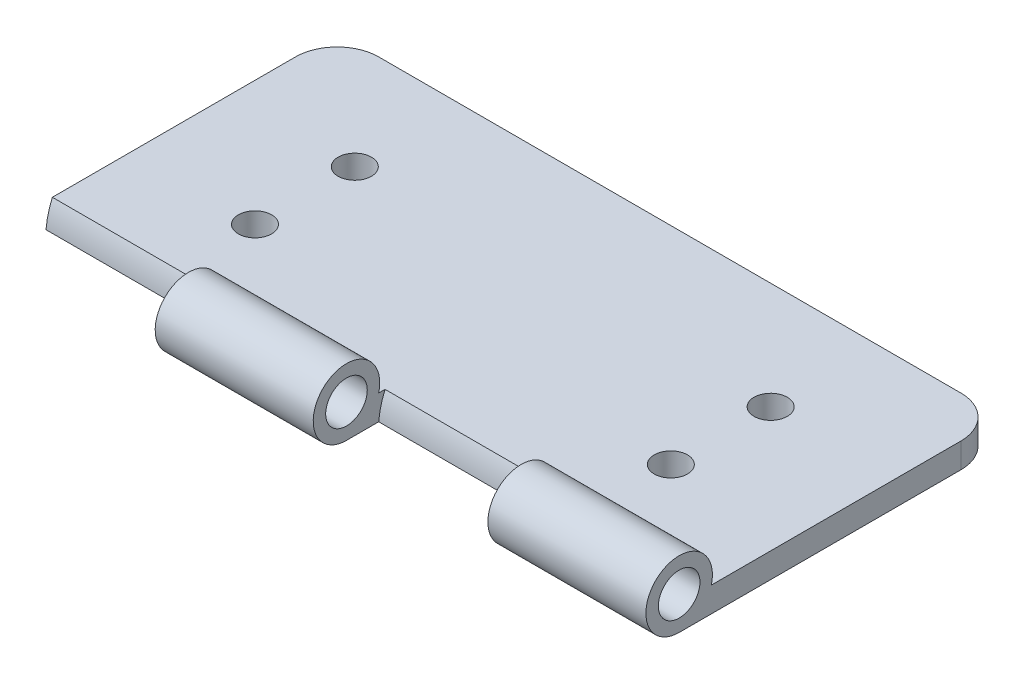
from build123d import *
from OCP.BRepFilletAPI import BRepFilletAPI_MakeChamfer

# Parameters (mm, degrees)
BOSS_EXTRUDE1_DEPTH = 3
SKETCH2_R           = 2.5
BOSS_EXTRUDE2_DEPTH = 19
LPATTERN1_COUNT     = 2
LPATTERN1_PITCH     = 40
CHAMFER3_SIZE       = 1
CHAMFER3_SIZE2      = 0.624869352
FILLET1_R           = 10
SKETCH_1_R          = 2
CUT_EXTRUDE_1_DEPTH = 49.039445083


with BuildPart() as part:
    # Sketch1 → Boss-Extrude1 (new body)
    with BuildSketch(Plane(origin=(0, 0, 0), x_dir=(1, 0, 0), z_dir=(0, 1, 0))):
        with BuildLine():
            Line((-35, 17.5), (35, 17.5))
            ThreePointArc((35, 17.5), (38.535533906, 16.035533906), (40, 12.5))
            Line((40, 12.5), (40, -17.5))
            Line((40, -17.5), (-40, -17.5))
            Line((-40, -17.5), (-40, 12.5))
            ThreePointArc((-40, 12.5), (-38.535533906, 16.035533906), (-35, 17.5))
        make_face()
    extrude(amount=BOSS_EXTRUDE1_DEPTH)

    # Sketch2 → Boss-Extrude2 (add)
    with BuildSketch(Plane(origin=(40, 0, 0), x_dir=(0, 0, -1), z_dir=(1, 0, 0))):
        with BuildLine():
            Line((-21.372983346, 0), (-17.5, 0))
            Line((-17.5, 0), (-17.5, 3))
            ThreePointArc((-17.5, 3), (-23.822473089, 7.16227766), (-21.372983346, 0))
        make_face()
        with Locations((-21.372983346, 4)):
            Circle(SKETCH2_R, mode=Mode.SUBTRACT)
    boss_extrude2 = extrude(amount=-BOSS_EXTRUDE2_DEPTH)

    # LPattern1: Boss-Extrude2 ×2
    with Locations(*[(-i * LPATTERN1_PITCH, 0, 0) for i in range(1, LPATTERN1_COUNT)]):
        add(boss_extrude2)

    # Chamfer3: one chamfer whose edges measure the first distance from different faces: ONE call of the kernel's chamfer builder (chamfer() names one face for all edges)
    chamfer3_edges_1 = [part.edges().sort_by_distance(p)[0] for p in [
        (-29.5, 3, 17.5),
    ]]
    chamfer3_side_1 = [part.faces().sort_by_distance(p)[0] for p in [
        (-29.5, 1.5, 17.5),
    ]]
    chamfer3_edges_2 = [part.edges().sort_by_distance(p)[0] for p in [
        (10.5, 3, 17.5),
    ]]
    chamfer3_side_2 = [part.faces().sort_by_distance(p)[0] for p in [
        (10.5, 1.5, 17.5),
    ]]
    chamfer3 = BRepFilletAPI_MakeChamfer(part.part.solid().wrapped)
    for e in chamfer3_edges_1:
        chamfer3.Add(CHAMFER3_SIZE, CHAMFER3_SIZE2, e.wrapped, chamfer3_side_1[0].wrapped)  # the first distance lies on this face
    for e in chamfer3_edges_2:
        chamfer3.Add(CHAMFER3_SIZE, CHAMFER3_SIZE2, e.wrapped, chamfer3_side_2[0].wrapped)  # the first distance lies on this face
    add(Compound.cast(chamfer3.Shape()), mode=Mode.REPLACE)

    # Fillet1
    # the kernel refuses this fillet: 10 mm, written as the material it takes off along each edge
    with BuildSketch(Plane(origin=(21, 2, 17.5), x_dir=(0, 0.8480480961564257, -0.5299192642332051), z_dir=(-1, 0, 0))) as fillet1_piece_1:
        with BuildLine():
            CenterArc((2.784251212, 10), FILLET1_R, 243.382335319, 26.617664681)
            Line((-1.696096192, 1.059838528), (0, 0))
            Line((0, 0), (2.784251212, 0))
        make_face()
    extrude(amount=21, mode=Mode.SUBTRACT)
    with BuildSketch(Plane(origin=(-19, 2, 17.5), x_dir=(0, 0.8480480961564257, -0.5299192642332051), z_dir=(-1, 0, 0))) as fillet1_piece_2:
        with BuildLine():
            CenterArc((2.784251212, 10), FILLET1_R, 243.382335319, 26.617664681)
            Line((-1.696096192, 1.059838528), (0, 0))
            Line((0, 0), (2.784251212, 0))
        make_face()
    extrude(amount=27.96062803, mode=Mode.SUBTRACT)

    # 스케치1 → 컷-돌출1 (cut, through all)
    with BuildSketch(Plane.XZ):
        with Locations(Location((-25, 7.372983346, 0), (0, 0, 270))):
            Circle(SKETCH_1_R)
        with Locations(Location((-25, -4.627016654, 0), (0, 0, 270))):
            Circle(SKETCH_1_R)
        with Locations(Location((25, 7.372983346, 0), (0, 0, 270))):
            Circle(SKETCH_1_R)
        with Locations(Location((25, -4.627016654, 0), (0, 0, 270))):
            Circle(SKETCH_1_R)
    extrude(amount=-CUT_EXTRUDE_1_DEPTH, mode=Mode.SUBTRACT)


solid = part.part
